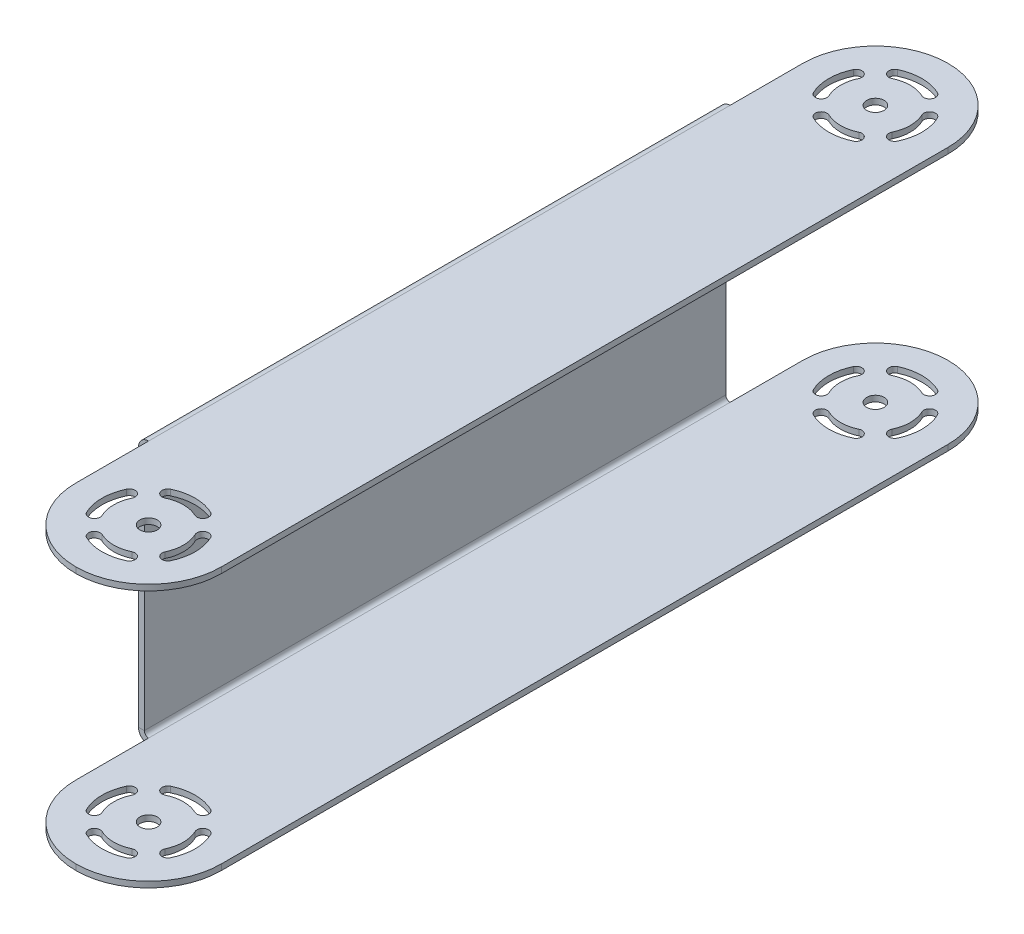
from build123d import *

# Parameters (mm, degrees)
SKETCH_1_W             = 25
SKETCH_1_H             = 100
SM_BASE_FLANGE_1_DEPTH = 1
SM_EDGE_FLANGE_1_DEPTH = 100
SM_EDGE_FLANGE_2_DEPTH = 100
SKETCH_18_W            = 25
SKETCH_18_H            = 1
EXTRUDE_1_DEPTH        = 25
FILLET_1_R             = 12.5
SKETCH_21_R            = 1.5
CUT_EXTRUDE_1_DEPTH    = 89.735735525
FILLET_1_OF_MIRROR_1_R = 12.5


# Sheet-metal steps are written as plain solids
with BuildPart() as part:
    # Sketch 1 → 基材-凸緣1 (new body)
    with BuildSketch(Plane(origin=(0, 0, 0), x_dir=(1, 0, 0), z_dir=(0, 1, 0))):
        Rectangle(SKETCH_1_W, SKETCH_1_H)
    extrude(amount=-SM_BASE_FLANGE_1_DEPTH)

    # 邊線-凸緣1 section (across the edge) → 邊線-凸緣1 (add)
    with BuildSketch(Plane(origin=(-13.2366, -1, 50), x_dir=(1, 0, 0), z_dir=(0, 0, -1))):
        with BuildLine():
            Line((-1, 0.7366), (-1, 42.5))
            Line((-1, 42.5), (0, 42.5))
            Line((0, 42.5), (0, 0.7366))
            ThreePointArc((0, 0.7366), (0.215745145, 0.215745145), (0.7366, 0))
            Line((0.7366, 0), (0.7366, -1))
            ThreePointArc((0.7366, -1), (-0.491361636, -0.491361636), (-1, 0.7366))
        make_face()
    extrude(amount=SM_EDGE_FLANGE_1_DEPTH)

    # 邊線-凸緣2 section (across the edge) → 邊線-凸緣2 (add)
    with BuildSketch(Plane(origin=(-13.2366, -44.2366, 50), x_dir=(0, 1, 0), z_dir=(0, 0, -1))):
        with BuildLine():
            Line((-1, 0.7366), (-1, 25.7366))
            Line((-1, 25.7366), (0, 25.7366))
            Line((0, 25.7366), (0, 0.7366))
            ThreePointArc((0, 0.7366), (0.215745145, 0.215745145), (0.7366, 0))
            Line((0.7366, 0), (0.7366, -1))
            ThreePointArc((0.7366, -1), (-0.491361636, -0.491361636), (-1, 0.7366))
        make_face()
    extrude(amount=SM_EDGE_FLANGE_2_DEPTH)

    # 草圖18 → 填料-伸長1 (add)
    with BuildSketch(Plane.XY.offset(50)):
        with Locations((0, -0.5)):
            Rectangle(SKETCH_18_W, SKETCH_18_H)
        with Locations((0, -44.7366)):
            Rectangle(SKETCH_18_W, SKETCH_18_H)
    extrude_1 = extrude(amount=EXTRUDE_1_DEPTH)

    # 圓角1
    fillet_1_edges = [part.edges().sort_by_distance(p)[0] for p in [
        (-12.5, -44.7366, 75),
        (12.5, -44.7366, 75),
        (12.5, -0.5, 75),
        (-12.5, -0.5, 75),
    ]]
    fillet(fillet_1_edges, radius=FILLET_1_R - 0.0001)  # a hair under: the kernel refuses the full size

    # 草圖21 → 除料-伸長1 (cut, through all)
    with BuildSketch(Plane(origin=(0, 0, 0), x_dir=(1, 0, 0), z_dir=(0, 1, 0))):
        with Locations(Location((0, -62.5, 0), (0, 0, 270))):
            Circle(SKETCH_21_R)
        with BuildLine():
            ThreePointArc((3.428571429, -55.271936777), (0, -54.5), (-3.428571429, -55.271936777))
            ThreePointArc((-3.428571429, -55.271936777), (-3.903507903, -56.604016108), (-2.571428571, -57.078952583))
            ThreePointArc((-2.571428571, -57.078952583), (0, -56.5), (2.571428571, -57.078952583))
            ThreePointArc((2.571428571, -57.078952583), (3.903507903, -56.604016108), (3.428571429, -55.271936777))
        make_face()
        with BuildLine():
            ThreePointArc((5.421047417, -65.071428571), (6, -62.5), (5.421047417, -59.928571429))
            ThreePointArc((5.421047417, -59.928571429), (5.895983892, -58.596492097), (7.228063223, -59.071428571))
            ThreePointArc((7.228063223, -59.071428571), (8, -62.5), (7.228063223, -65.928571429))
            ThreePointArc((7.228063223, -65.928571429), (5.895983892, -66.403507903), (5.421047417, -65.071428571))
        make_face()
        with BuildLine():
            ThreePointArc((-2.571428571, -67.921047417), (0, -68.5), (2.571428571, -67.921047417))
            ThreePointArc((2.571428571, -67.921047417), (3.903507903, -68.395983892), (3.428571429, -69.728063223))
            ThreePointArc((3.428571429, -69.728063223), (0, -70.5), (-3.428571429, -69.728063223))
            ThreePointArc((-3.428571429, -69.728063223), (-3.903507903, -68.395983892), (-2.571428571, -67.921047417))
        make_face()
        with BuildLine():
            ThreePointArc((-5.421047417, -59.928571429), (-6, -62.5), (-5.421047417, -65.071428571))
            ThreePointArc((-5.421047417, -65.071428571), (-5.895983892, -66.403507903), (-7.228063223, -65.928571429))
            ThreePointArc((-7.228063223, -65.928571429), (-8, -62.5), (-7.228063223, -59.071428571))
            ThreePointArc((-7.228063223, -59.071428571), (-5.895983892, -58.596492097), (-5.421047417, -59.928571429))
        make_face()
    cut_extrude_1 = extrude(amount=-CUT_EXTRUDE_1_DEPTH, mode=Mode.SUBTRACT)

    # 鏡射1: 填料-伸長1, 除料-伸長1 across plane
    add(extrude_1.mirror(Plane.XY))
    add(cut_extrude_1.mirror(Plane.XY), mode=Mode.SUBTRACT)

    # 圓角1 of 鏡射1
    fillet_1_of_mirror_1_edges = [part.edges().sort_by_distance(p)[0] for p in [
        (-12.5, -44.7366, -75),
        (12.5, -44.7366, -75),
        (12.5, -0.5, -75),
        (-12.5, -0.5, -75),
    ]]
    fillet(fillet_1_of_mirror_1_edges, radius=FILLET_1_OF_MIRROR_1_R - 0.0001)  # a hair under: the kernel refuses the full size


solid = part.part
